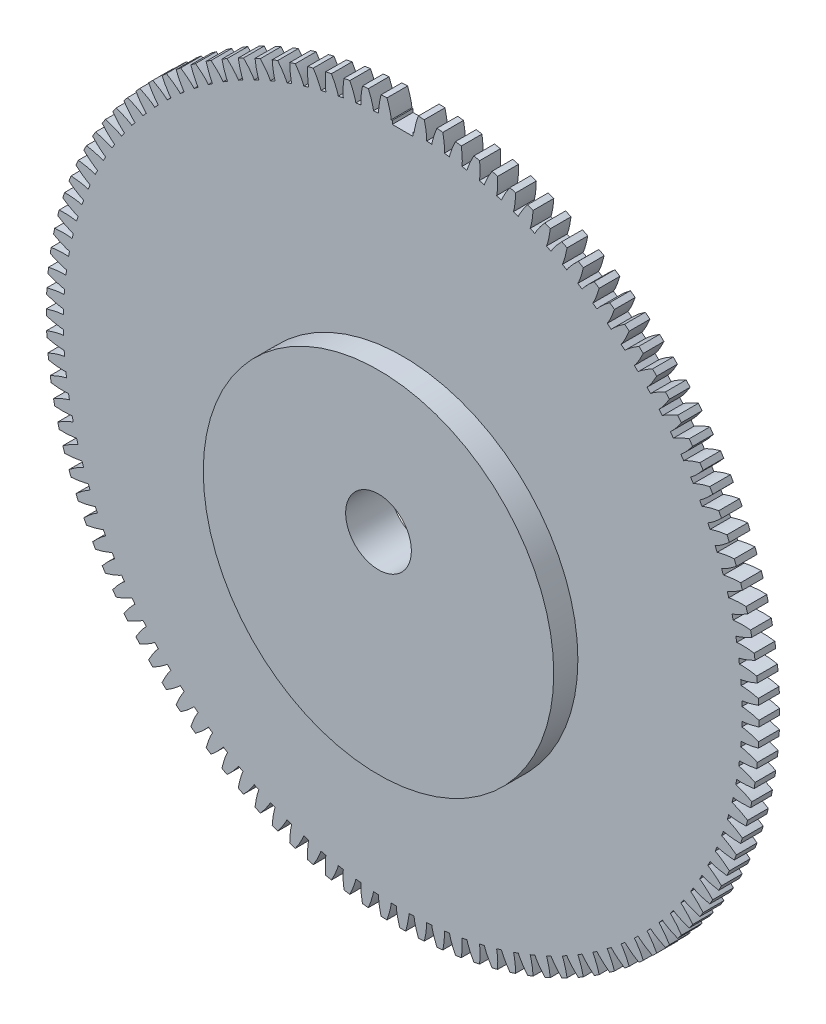
from build123d import *

# Parameters (mm, degrees)
SKETCH1_R               = 51.646666667
BOSS_EXTRUDE1_DEPTH     = 3
CUT_EXTRUDE2_DEPTH      = 4
CIRPATTERN1_COUNT       = 120
SKETCH3_R               = 25.4
BOSS_EXTRUDE2_DEPTH     = 3.5
CUT_EXTRUDE4_DEPTH      = 4
CUT_EXTRUDE4_DEPTH_BACK = 4
SKETCH4_W               = 3
SKETCH4_H               = 4.5
CUT_EXTRUDE6_DEPTH      = 8.5
CUT_EXTRUDE6_DEPTH_BACK = 8.5
SKETCH5_R               = 4.7625


with BuildPart() as part:
    # Sketch1 → Boss-Extrude1 (new body)
    with BuildSketch(Plane.XY):
        Circle(SKETCH1_R)
    extrude(amount=BOSS_EXTRUDE1_DEPTH)

    # Sketch2 → Cut-Extrude2 (cut, symmetric)
    with BuildSketch(Plane.XY):
        with BuildLine():
            add(Edge.make_bspline(
                [(49.173361018, 0.916442431), (49.183840602, 0.916566665), (49.203665365, 0.916389813), (49.236041926, 0.915655791), (49.281069694, 0.913831661), (49.33450746, 0.91092478), (49.39754984, 0.906541319), (49.46694205, 0.9007175), (49.542570565, 0.893292721), (49.618148152, 0.884920911), (49.693668139, 0.875669614), (49.769018239, 0.865640937), (49.860443198, 0.852529408), (49.970286862, 0.835466838), (50.09901943, 0.813561626), (50.245444787, 0.786397303), (50.395173533, 0.75621663), (50.542926329, 0.724464568), (50.692735681, 0.690005727), (50.838058859, 0.654980196), (50.989598467, 0.616143688), (51.129772554, 0.579049351), (51.287526439, 0.534752027), (51.415036199, 0.498206693), (51.547379052, 0.458157155), (51.61188554, 0.438324841), (51.644892822, 0.428045758)],
                knots=[0, 0, 0, 0, 0, 0.015083688, 0.02853182, 0.04661014, 0.06485485, 0.092110526, 0.119476176, 0.146842496, 0.174208854, 0.201574956, 0.228941013, 0.256307345, 0.307035032, 0.361767352, 0.416499661, 0.471231937, 0.525964282, 0.580696616, 0.635428982, 0.690161387, 0.744893688, 0.799626082, 0.854358407, 0.909090914, 0.909090914, 0.909090914, 0.909090914, 0.909090914], degree=4))
            Line((51.644892822, 0.428045758), (59.997939254, 0.497277891))
            add(Edge.make_bspline(
                [(59.997939254, 0.497277891), (59.997762721, 0.518577016), (59.99738986, 0.560060691), (59.996393061, 0.664567115), (59.995381809, 0.744521068), (59.99390127, 0.860121464), (59.992423545, 0.954281965), (59.990665516, 1.06137839), (59.988796095, 1.160669103), (59.986716856, 1.264630009), (59.984481052, 1.365844925), (59.982066985, 1.468568948), (59.979470379, 1.570617707), (59.976722607, 1.672662508), (59.973757206, 1.775372094), (59.970692767, 1.876565311), (59.967328262, 1.980492562), (59.963998646, 2.079745038), (59.960149273, 2.186786699), (59.956696993, 2.280895494), (59.952125445, 2.396414949), (59.948950845, 2.476312253), (59.944476834, 2.580727623), (59.942678097, 2.622173961), (59.941739677, 2.643453134)],
                knots=[0.083333333, 0.083333333, 0.083333333, 0.083333333, 0.083333333, 0.123015873, 0.162698413, 0.202380952, 0.242063492, 0.281746032, 0.321428571, 0.361111111, 0.400793651, 0.44047619, 0.48015873, 0.51984127, 0.55952381, 0.599206349, 0.638888889, 0.678571429, 0.718253968, 0.757936508, 0.797619048, 0.837301587, 0.876984127, 0.916666667, 0.916666667, 0.916666667, 0.916666667, 0.916666667], degree=4))
            Line((59.941739677, 2.643453134), (51.596517475, 2.275425715))
            add(Edge.make_bspline(
                [(49.153933526, 1.658348392), (49.16440525, 1.658772788), (49.184193589, 1.659986945), (49.216487364, 1.662414419), (49.261357955, 1.66659262), (49.314570351, 1.672292235), (49.377296922, 1.679969072), (49.446289237, 1.689416617), (49.521425523, 1.70078931), (49.596461386, 1.713105072), (49.671393701, 1.726296102), (49.746115675, 1.740254554), (49.836729135, 1.758132927), (49.945529276, 1.780920887), (50.072938991, 1.80953342), (50.217742006, 1.844323827), (50.365686019, 1.882299335), (50.511574551, 1.921740666), (50.659375158, 1.963992699), (50.802666081, 2.006575856), (50.951965464, 2.05329011), (51.090006079, 2.097669755), (51.245225426, 2.150162571), (51.370647802, 2.193331167), (51.500713253, 2.240252108), (51.564093394, 2.263433252), (51.596517475, 2.275425715)],
                knots=[0, 0, 0, 0, 0, 0.015083688, 0.02853182, 0.04661014, 0.06485485, 0.092110526, 0.119476176, 0.146842496, 0.174208854, 0.201574956, 0.228941013, 0.256307345, 0.307035032, 0.361767352, 0.416499661, 0.471231937, 0.525964282, 0.580696616, 0.635428982, 0.690161387, 0.744893688, 0.799626082, 0.854358407, 0.909090914, 0.909090914, 0.909090914, 0.909090914, 0.909090914], degree=4))
            Line((49.153933526, 1.658348392), (49.173361018, 0.916442431))
        make_face()
    cut_extrude2 = extrude(amount=CUT_EXTRUDE2_DEPTH, both=True, mode=Mode.SUBTRACT)

    # CirPattern1: Cut-Extrude2 ×120 about axis
    cirpattern1_axis = Axis((0, 0, -0.325), (0, 0, 1))
    for i in range(1, CIRPATTERN1_COUNT):
        add(cut_extrude2.rotate(cirpattern1_axis, i * 360 / CIRPATTERN1_COUNT), mode=Mode.SUBTRACT)

    # Sketch3 → Boss-Extrude2 (add)
    with BuildSketch(Plane.XY.offset(3)):
        with Locations((0, -5.08)):
            Circle(SKETCH3_R)
    extrude(amount=BOSS_EXTRUDE2_DEPTH)

    # Sketch4 → Cut-Extrude4 (cut, two sides: drawn at the far end of the back side and taken through both)
    with BuildSketch(Plane.XY.offset(-CUT_EXTRUDE4_DEPTH_BACK)):
        with Locations((0, 50.896666667)):
            Rectangle(SKETCH4_W, SKETCH4_H)
    extrude(amount=CUT_EXTRUDE4_DEPTH + CUT_EXTRUDE4_DEPTH_BACK, mode=Mode.SUBTRACT)

    # Sketch5 → Cut-Extrude6 (cut, two sides: drawn at the far end of the back side and taken through both)
    with BuildSketch(Plane.XY.offset(-CUT_EXTRUDE6_DEPTH_BACK)):
        Circle(SKETCH5_R)
    extrude(amount=CUT_EXTRUDE6_DEPTH + CUT_EXTRUDE6_DEPTH_BACK, mode=Mode.SUBTRACT)


solid = part.part
